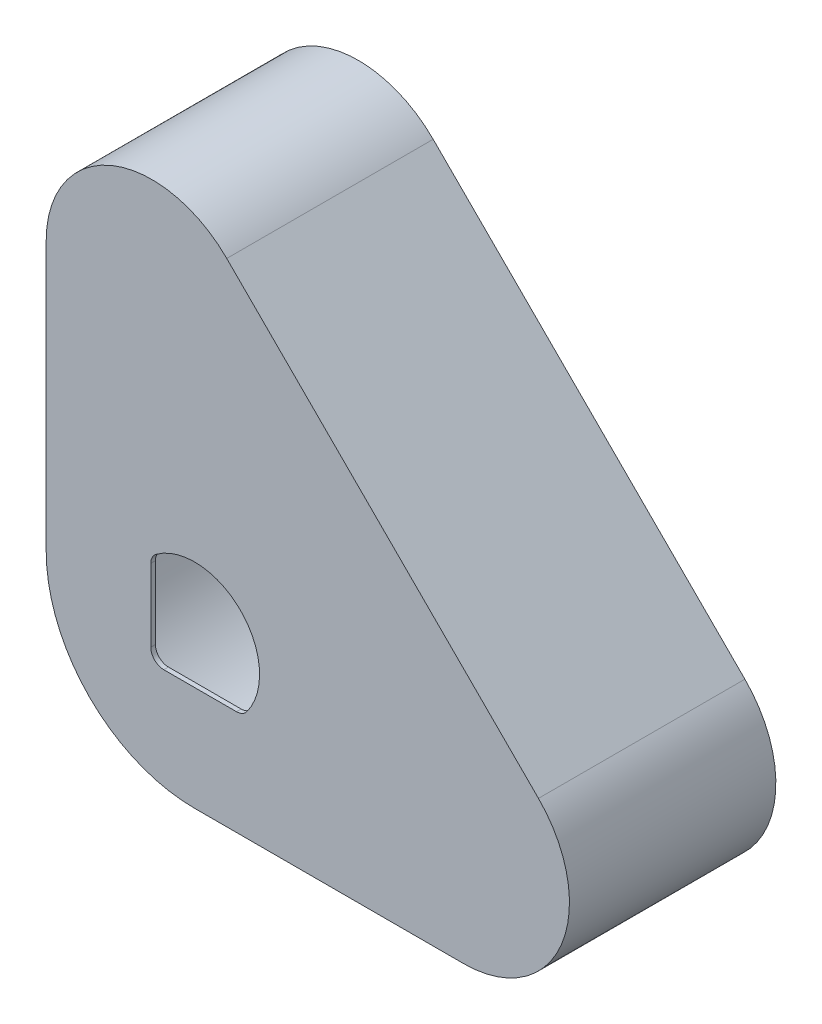
from build123d import *

# Parameters (mm, degrees)
BOSS_EXTRUDE1_DEPTH = 70.64375
SHELL2_T            = -1.5875
CUT_EXTRUDE1_DEPTH  = 195.671326122


with BuildPart() as part:
    # Sketch2 → Boss-Extrude1 (new body)
    with BuildSketch(Plane.XY):
        with BuildLine():
            Line((-50.8, 0), (-50.8, 92.075))
            ThreePointArc((-50.8, 92.075), (-28.456226834, 125.514819679), (10.988729945, 117.668729945))
            Line((10.988729945, 117.668729945), (117.668729945, 10.988729945))
            ThreePointArc((117.668729945, 10.988729945), (125.514819679, -28.456226834), (92.075, -50.8))
            Line((92.075, -50.8), (0, -50.8))
            ThreePointArc((0, -50.8), (-35.921024484, -35.921024484), (-50.8, 0))
        make_face()
    extrude(amount=BOSS_EXTRUDE1_DEPTH)

    # Shell2
    shell2_openings = [part.faces().sort_by_distance(p)[0] for p in [
        (23.696852403, 23.696852403, 0),
    ]]
    offset(amount=SHELL2_T, openings=shell2_openings, kind=Kind.INTERSECTION)

    # Sketch3 → Cut-Extrude1 (cut, through all)
    with BuildSketch(Plane.XY.offset(70.64375)):
        with BuildLine():
            Line((-10.560403568, -14.996859661), (14.31036889, -14.996859661))
            ThreePointArc((14.31036889, -14.996859661), (16.314398699, -14.519464672), (17.88796111, -13.189824575))
            ThreePointArc((17.88796111, -13.189824575), (15.710755061, 15.720139961), (-13.200504503, 17.880081275))
            ThreePointArc((-13.200504503, 17.880081275), (-14.528606837, 16.30691004), (-15.005403568, 14.304064973))
            Line((-15.005403568, 14.304064973), (-15.005403568, -10.551859661))
            ThreePointArc((-15.005403568, -10.551859661), (-13.70349321, -13.694949304), (-10.560403568, -14.996859661))
        make_face()
    extrude(amount=-CUT_EXTRUDE1_DEPTH, mode=Mode.SUBTRACT)


solid = part.part
